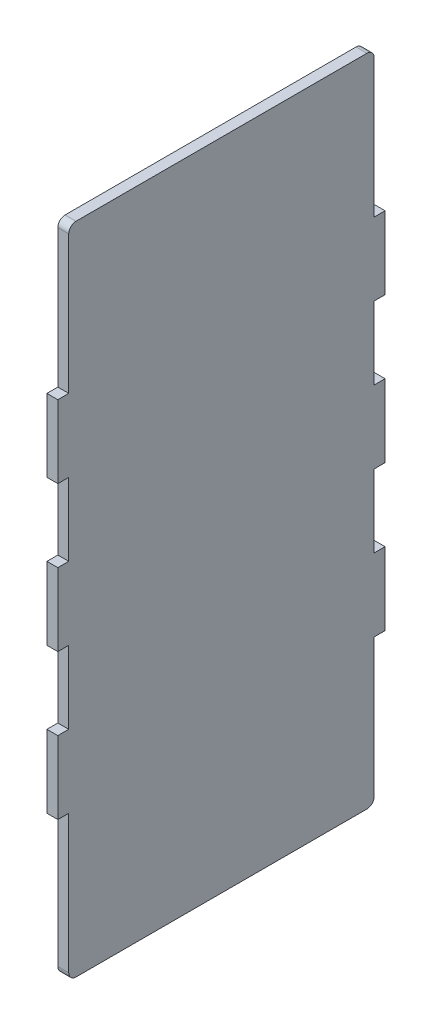
from build123d import *

# Parameters (mm, degrees)
SKETCH1_W           = 3
SKETCH1_H           = 180
EXTRUDE_THIN1_DEPTH = 90
CAVITY1_START       = -65.602294015
CAVITY1_OUTLINE_W   = 3
CAVITY1_OUTLINE_H   = 3
CAVITY1_DEPTH       = 40
CAVITY1_START_2     = 74.397705985
CAVITY1_2_OUTLINE_W = 3
CAVITY1_2_OUTLINE_H = 3
CAVITY1_2_DEPTH     = 40
CAVITY1_START_3     = -5.602294015
CAVITY1_3_OUTLINE_W = 3
CAVITY1_3_OUTLINE_H = 3
CAVITY1_3_DEPTH     = 20
CAVITY1_START_4     = 34.397705985
CAVITY1_4_OUTLINE_W = 3
CAVITY1_4_OUTLINE_H = 3
CAVITY1_4_DEPTH     = 20
FILLET1_R           = 2


# Read off the part's stored shape, not the designer's step: Cavity1
with BuildPart() as part:
    # Sketch1 → Extrude-Thin1 (new body)
    with BuildSketch(Plane.XY.offset(1.5)):
        with Locations((-92.414893617, 24.397705985)):
            Rectangle(SKETCH1_W, SKETCH1_H)
    extrude(amount=-EXTRUDE_THIN1_DEPTH)

    # Cavity1 outline → Cavity1 (cut)
    with BuildSketch(Plane(origin=(0, 0, 0), x_dir=(1, 0, 0), z_dir=(0, 1, 0)).offset(CAVITY1_START)):
        with Locations((-92.414893617, 87)):
            Rectangle(CAVITY1_OUTLINE_W, CAVITY1_OUTLINE_H)
        with Locations((-92.414893617, 0)):
            Rectangle(CAVITY1_OUTLINE_W, CAVITY1_OUTLINE_H)
    extrude(amount=CAVITY1_DEPTH, mode=Mode.SUBTRACT)

    # Cavity1 2 outline → Cavity1 2 (cut)
    with BuildSketch(Plane(origin=(0, 0, 0), x_dir=(1, 0, 0), z_dir=(0, 1, 0)).offset(CAVITY1_START_2)):
        with Locations((-92.414893617, 87)):
            Rectangle(CAVITY1_2_OUTLINE_W, CAVITY1_2_OUTLINE_H)
        with Locations((-92.414893617, 0)):
            Rectangle(CAVITY1_2_OUTLINE_W, CAVITY1_2_OUTLINE_H)
    extrude(amount=CAVITY1_2_DEPTH, mode=Mode.SUBTRACT)

    # Cavity1 3 outline → Cavity1 3 (cut)
    with BuildSketch(Plane(origin=(0, 0, 0), x_dir=(1, 0, 0), z_dir=(0, 1, 0)).offset(CAVITY1_START_3)):
        with Locations((-92.414893617, 87)):
            Rectangle(CAVITY1_3_OUTLINE_W, CAVITY1_3_OUTLINE_H)
        with Locations((-92.414893617, 0)):
            Rectangle(CAVITY1_3_OUTLINE_W, CAVITY1_3_OUTLINE_H)
    extrude(amount=CAVITY1_3_DEPTH, mode=Mode.SUBTRACT)

    # Cavity1 4 outline → Cavity1 4 (cut)
    with BuildSketch(Plane(origin=(0, 0, 0), x_dir=(1, 0, 0), z_dir=(0, 1, 0)).offset(CAVITY1_START_4)):
        with Locations((-92.414893617, 87)):
            Rectangle(CAVITY1_4_OUTLINE_W, CAVITY1_4_OUTLINE_H)
        with Locations((-92.414893617, 0)):
            Rectangle(CAVITY1_4_OUTLINE_W, CAVITY1_4_OUTLINE_H)
    extrude(amount=CAVITY1_4_DEPTH, mode=Mode.SUBTRACT)

    # Fillet1
    fillet1_edges = [part.edges().sort_by_distance(p)[0] for p in [
        (-92.414893617, -65.602294015, -85.5),
        (-92.414893617, 114.397705985, -85.5),
        (-92.414893617, 114.397705985, -1.5),
        (-92.414893617, -65.602294015, -1.5),
    ]]
    fillet(fillet1_edges, radius=FILLET1_R)


solid = part.part
